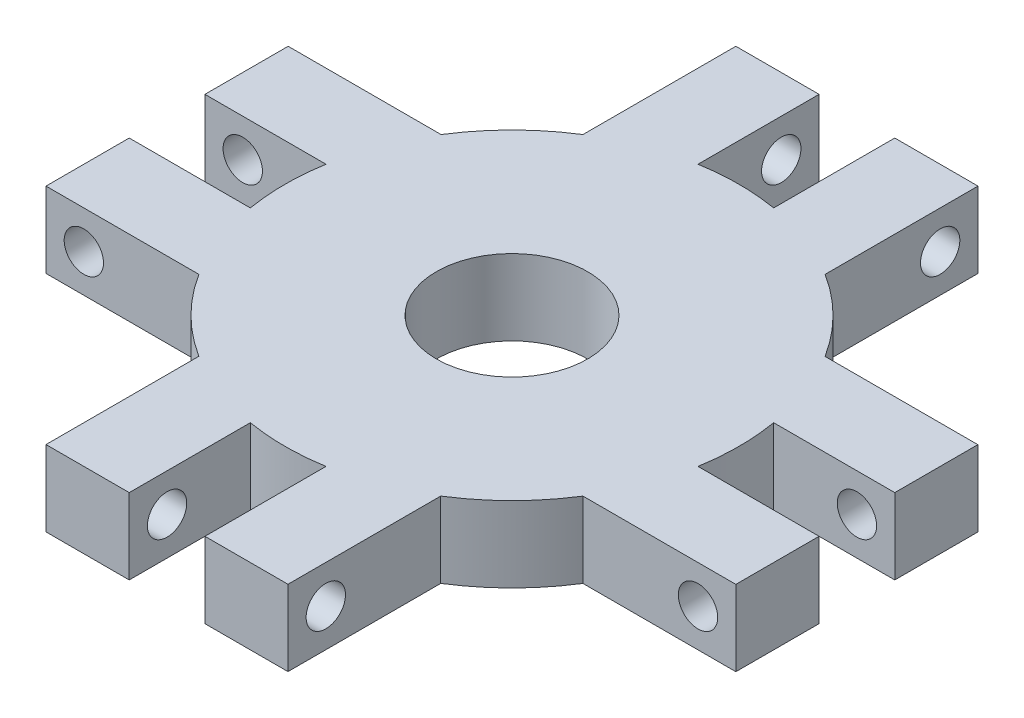
from build123d import *

# Parameters (mm, degrees)
BOSS_EXTRUDE1_DEPTH = 6.35
SKETCH2_R           = 1.651
CUT_EXTRUDE1_DEPTH  = 23.368
SKETCH3_R           = 1.651
CUT_EXTRUDE2_DEPTH  = 23.368
SKETCH4_R           = 1.651
CUT_EXTRUDE3_DEPTH  = 23.368
SKETCH5_R           = 1.651
CUT_EXTRUDE4_DEPTH  = 23.368
SKETCH6_R           = 6.35
CUT_EXTRUDE5_DEPTH  = 14.3002


with BuildPart() as part:
    # Sketch1 → Boss-Extrude1 (new body)
    with BuildSketch(Plane(origin=(0, 0, 0), x_dir=(1, 0, 0), z_dir=(0, 1, 0))):
        with BuildLine():
            Line((-3.175, 18.783553311), (-3.175, 28.943553311))
            Line((-3.175, 28.943553311), (-10.16, 28.943553311))
            Line((-10.16, 28.943553311), (-10.16, 16.114493476))
            ThreePointArc((-10.16, 16.114493476), (-13.470384182, 13.470384182), (-16.114493476, 10.16))
            Line((-16.114493476, 10.16), (-28.943553311, 10.16))
            Line((-28.943553311, 10.16), (-28.943553311, 3.175))
            Line((-28.943553311, 3.175), (-18.783553311, 3.175))
            ThreePointArc((-18.783553311, 3.175), (-19.05, 0), (-18.783553311, -3.175))
            Line((-18.783553311, -3.175), (-28.943553311, -3.175))
            Line((-28.943553311, -3.175), (-28.943553311, -10.16))
            Line((-28.943553311, -10.16), (-16.114493476, -10.16))
            ThreePointArc((-16.114493476, -10.16), (-13.470384182, -13.470384182), (-10.16, -16.114493476))
            Line((-10.16, -16.114493476), (-10.16, -28.943553311))
            Line((-10.16, -28.943553311), (-3.175, -28.943553311))
            Line((-3.175, -28.943553311), (-3.175, -18.783553311))
            ThreePointArc((-3.175, -18.783553311), (0, -19.05), (3.175, -18.783553311))
            Line((3.175, -18.783553311), (3.175, -28.943553311))
            Line((3.175, -28.943553311), (10.144252899, -28.943553311))
            Line((10.144252899, -28.943553311), (10.144252899, -16.124411094))
            ThreePointArc((10.144252899, -16.124411094), (13.463802963, -13.476962186), (16.114493476, -10.16))
            Line((16.114493476, -10.16), (28.943553311, -10.16))
            Line((28.943553311, -10.16), (28.943553311, -3.175))
            Line((28.943553311, -3.175), (18.783553311, -3.175))
            ThreePointArc((18.783553311, -3.175), (19.05, 0), (18.783553311, 3.175))
            Line((18.783553311, 3.175), (28.943553311, 3.175))
            Line((28.943553311, 3.175), (28.943553311, 10.146623982))
            Line((28.943553311, 10.146623982), (16.122919145, 10.146623982))
            ThreePointArc((16.122919145, 10.146623982), (13.475972183, 13.464793861), (10.16, 16.114493476))
            Line((10.16, 16.114493476), (10.16, 28.943553311))
            Line((10.16, 28.943553311), (3.175, 28.943553311))
            Line((3.175, 28.943553311), (3.175, 18.783553311))
            ThreePointArc((3.175, 18.783553311), (0, 19.05), (-3.175, 18.783553311))
        make_face()
    extrude(amount=BOSS_EXTRUDE1_DEPTH)

    # Sketch2 → Cut-Extrude1 (cut)
    with BuildSketch(Plane(origin=(10.16, 0, 0), x_dir=(0, 0, -1), z_dir=(1, 0, 0))):
        with Locations((25.768553311, 3.175)):
            Circle(SKETCH2_R)
    extrude(amount=-CUT_EXTRUDE1_DEPTH, mode=Mode.SUBTRACT)

    # Sketch3 → Cut-Extrude2 (cut)
    with BuildSketch(Plane(origin=(0, 0, -10.146623982), x_dir=(-1, 0, 0), z_dir=(0, 0, -1))):
        with Locations((-25.768553311, 3.175)):
            Circle(SKETCH3_R)
    extrude(amount=-CUT_EXTRUDE2_DEPTH, mode=Mode.SUBTRACT)

    # Sketch4 → Cut-Extrude3 (cut)
    with BuildSketch(Plane(origin=(10.144252899, 0, 0), x_dir=(0, 0, -1), z_dir=(1, 0, 0))):
        with Locations((-25.768553311, 3.175)):
            Circle(SKETCH4_R)
    extrude(amount=-CUT_EXTRUDE3_DEPTH, mode=Mode.SUBTRACT)

    # Sketch5 → Cut-Extrude4 (cut)
    with BuildSketch(Plane.XY.offset(10.16)):
        with Locations((-25.768553311, 3.175)):
            Circle(SKETCH5_R)
    extrude(amount=-CUT_EXTRUDE4_DEPTH, mode=Mode.SUBTRACT)

    # Sketch6 → Cut-Extrude5 (cut)
    with BuildSketch(Plane(origin=(0, 6.35, 0), x_dir=(1, 0, 0), z_dir=(0, 1, 0))):
        Circle(SKETCH6_R)
    extrude(amount=-CUT_EXTRUDE5_DEPTH, mode=Mode.SUBTRACT)


solid = part.part
